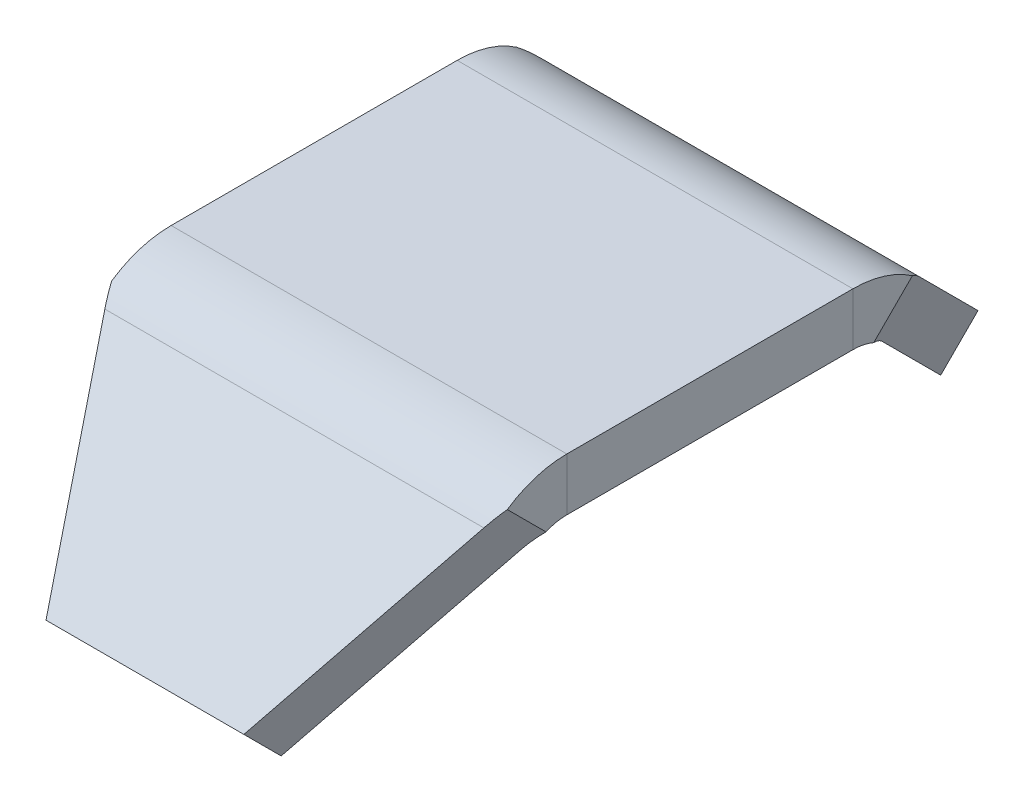
from build123d import *
from OCP.BRepFilletAPI import BRepFilletAPI_MakeChamfer

# Parameters (mm, degrees)
SM_BASE_FLANGE_1_DEPTH = 60
CHAMFER_2_SIZE         = 35
CHAMFER_2_SIZE2        = 15
CHAMFER_3_SIZE         = 15
CHAMFER_3_SIZE2        = 35


# Sheet-metal steps are written as plain solids
with BuildPart() as part:
    # Sketch 1 → 基体-法兰1 (new body)
    with BuildSketch(Plane(origin=(0, 0, 0), x_dir=(0, 0, -1), z_dir=(1, 0, 0))):
        with BuildLine():
            Line((-50, -25), (-27.343145751, -2.343145751))
            ThreePointArc((-27.343145751, -2.343145751), (-24.74775896, -0.60896374), (-21.686291501, 0))
            Line((-21.686291501, 0), (21.686291501, 0))
            ThreePointArc((21.686291501, 0), (24.74775896, -0.60896374), (27.343145751, -2.343145751))
            Line((27.343145751, -2.343145751), (50, -25))
            Line((50, -25), (55.656854249, -19.343145751))
            Line((55.656854249, -19.343145751), (33, 3.313708499))
            ThreePointArc((33, 3.313708499), (27.809226419, 6.78207252), (21.686291501, 8))
            Line((21.686291501, 8), (-21.686291501, 8))
            ThreePointArc((-21.686291501, 8), (-27.809226419, 6.78207252), (-33, 3.313708499))
            Line((-33, 3.313708499), (-55.656854249, -19.343145751))
            Line((-55.656854249, -19.343145751), (-50, -25))
        make_face()
    extrude(amount=SM_BASE_FLANGE_1_DEPTH)

    # 倒角2
    chamfer_2_edges = [part.edges().sort_by_distance(p)[0] for p in [
        (60, -22.171572875, 52.828427125),
        (60, -22.171572875, -52.828427125),
    ]]
    chamfer_2_side = [part.faces().sort_by_distance(p)[0] for p in [
        (60, -8.83568579, 43.50745996),
    ]]
    chamfer(chamfer_2_edges, length=CHAMFER_2_SIZE, length2=CHAMFER_2_SIZE2, reference=chamfer_2_side[0])

    # 倒角3: one chamfer whose edges measure the first distance from different faces: ONE call of the kernel's chamfer builder (chamfer() names one face for all edges)
    chamfer_3_edges_1 = [part.edges().sort_by_distance(p)[0] for p in [
        (0, -22.171572875, 52.828427125),
    ]]
    chamfer_3_side_1 = [part.faces().sort_by_distance(p)[0] for p in [
        (22.5, -22.171572875, 52.828427125),
    ]]
    chamfer_3_edges_2 = [part.edges().sort_by_distance(p)[0] for p in [
        (0, -22.171572875, -52.828427125),
    ]]
    chamfer_3_side_2 = [part.faces().sort_by_distance(p)[0] for p in [
        (22.5, -22.171572875, -52.828427125),
    ]]
    chamfer_3 = BRepFilletAPI_MakeChamfer(part.part.solid().wrapped)
    for e in chamfer_3_edges_1:
        chamfer_3.Add(CHAMFER_3_SIZE, CHAMFER_3_SIZE2, e.wrapped, chamfer_3_side_1[0].wrapped)  # the first distance lies on this face
    for e in chamfer_3_edges_2:
        chamfer_3.Add(CHAMFER_3_SIZE, CHAMFER_3_SIZE2, e.wrapped, chamfer_3_side_2[0].wrapped)  # the first distance lies on this face
    add(Compound.cast(chamfer_3.Shape()), mode=Mode.REPLACE)


solid = part.part
